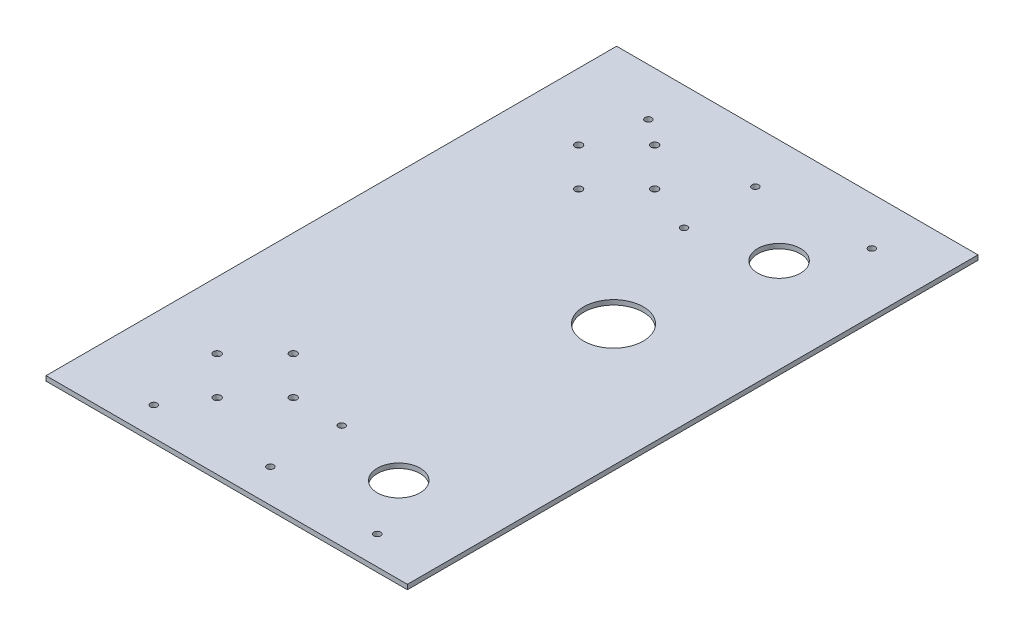
from build123d import *

# Parameters (mm, degrees)
SKETCH1_W                    = 241.3
SKETCH1_H                    = 381
BOSS_EXTRUDE1_DEPTH          = 3.175
F_10_0_1935_DIAMETER_HOLE1_D = 4.9149
SKETCH7_R                    = 14.2875
CUT_EXTRUDE3_DEPTH           = 226.514418885
SKETCH10_R                   = 2.2479
CUT_EXTRUDE5_DEPTH           = 226.514418885
SKETCH8_R                    = 19.868411907
CUT_EXTRUDE4_DEPTH           = 226.514418885


with BuildPart() as part:
    # Sketch1 → Boss-Extrude1 (new body)
    with BuildSketch(Plane(origin=(0, 0, 0), x_dir=(1, 0, 0), z_dir=(0, 1, 0))):
        Rectangle(SKETCH1_W, SKETCH1_H)
    extrude(amount=BOSS_EXTRUDE1_DEPTH)

    # #10 (0.1935) Diameter Hole1 (through all)
    with Locations(Plane(origin=(0, 3.175, 0), x_dir=(1, 0, 0), z_dir=(0, 1, 0))):
        with Locations((-50.8, -146.05), (-76.2, -120.65), (-50.8, -95.25), (-25.4, -120.65), (-50.8, 146.05), (-76.2, 120.65), (-50.8, 95.25), (-25.4, 120.65)):
            Hole(F_10_0_1935_DIAMETER_HOLE1_D / 2)

    # Sketch7 → Cut-Extrude3 (cut, through all)
    with BuildSketch(Plane(origin=(0, 3.175, 0), x_dir=(1, 0, 0), z_dir=(0, 1, 0))):
        with Locations((57.708419, -133.35)):
            Circle(SKETCH7_R)
        with Locations((57.708419, 120.65)):
            Circle(SKETCH7_R)
    extrude(amount=-CUT_EXTRUDE3_DEPTH, mode=Mode.SUBTRACT)

    # Sketch10 → Cut-Extrude5 (cut, through all)
    with BuildSketch(Plane(origin=(0, 3.175, 0), x_dir=(1, 0, 0), z_dir=(0, 1, 0))):
        with Locations((6.908419, -120.65)):
            Circle(SKETCH10_R)
        with Locations((-67.704081, -171.45)):
            Circle(SKETCH10_R)
        with Locations((6.908419, -168.275)):
            Circle(SKETCH10_R)
        with Locations((81.520919, -171.45)):
            Circle(SKETCH10_R)
        with Locations((81.520919, 158.75)):
            Circle(SKETCH10_R)
        with Locations((6.908419, 155.575)):
            Circle(SKETCH10_R)
        with Locations((6.908419, 107.95)):
            Circle(SKETCH10_R)
        with Locations((-67.704081, 158.75)):
            Circle(SKETCH10_R)
    extrude(amount=-CUT_EXTRUDE5_DEPTH, mode=Mode.SUBTRACT)

    # Sketch8 → Cut-Extrude4 (cut, through all)
    with BuildSketch(Plane(origin=(0, 3.175, 0), x_dir=(1, 0, 0), z_dir=(0, 1, 0))):
        with Locations((38.883538069, 28.882162108)):
            Circle(SKETCH8_R)
    extrude(amount=-CUT_EXTRUDE4_DEPTH, mode=Mode.SUBTRACT)


solid = part.part
